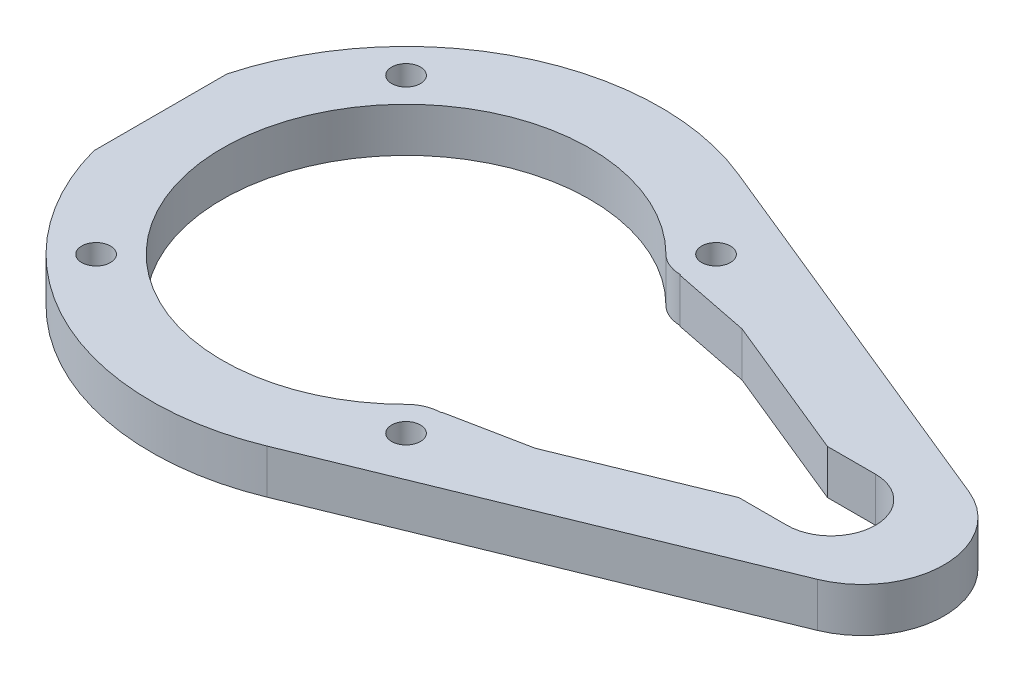
from build123d import *

# Parameters (mm, degrees)
SKETCH1_R           = 3.25
BOSS_EXTRUDE1_DEPTH = 10


with BuildPart() as part:
    # Sketch1 → Boss-Extrude1 (new body)
    with BuildSketch(Plane(origin=(0, 0, 0), x_dir=(1, 0, 0), z_dir=(0, 1, 0))):
        with BuildLine():
            ThreePointArc((21.76947877, 53.217002819), (-25.477840581, 51.544536415), (-55.5, 15.023634545))
            Line((-55.5, 15.023634545), (-55.5, -15.023634545))
            ThreePointArc((-55.5, -15.023634545), (-25.477840581, -51.544536415), (21.76947877, -53.217002819))
            Line((21.76947877, -53.217002819), (110.004400793, -17.122744217))
            ThreePointArc((110.004400793, -17.122744217), (121.5, 0), (110.004400793, 17.122744217))
            Line((110.004400793, 17.122744217), (21.76947877, 53.217002819))
        make_face()
        with Locations((-35, 35)):
            Circle(SKETCH1_R, mode=Mode.SUBTRACT)
        with BuildLine():
            ThreePointArc((29.343145829, 29.343145672), (31.938532593, 27.608963719), (35, 27))
            Line((35, 27), (35, 26.842197909))
            Line((35, 26.842197909), (52.547252782, 23.339790487))
            Line((52.547252782, 23.339790487), (85.157297123, 10))
            Line((85.157297123, 10), (96, 10))
            ThreePointArc((96, 10), (106, 0), (96, -10))
            Line((96, -10), (85.157297123, -10))
            Line((85.157297123, -10), (52.547252782, -23.339790487))
            Line((52.547252782, -23.339790487), (35, -26.842197909))
            Line((35, -26.842197909), (35, -27))
            ThreePointArc((35, -27), (31.938532454, -27.608963776), (29.343145617, -29.343145884))
            ThreePointArc((29.343145617, -29.343145884), (-41.497474683, 1.5e-07), (29.343145829, 29.343145672))
        make_face(mode=Mode.SUBTRACT)
        with Locations((35, 35)):
            Circle(SKETCH1_R, mode=Mode.SUBTRACT)
        with Locations((-35, -35)):
            Circle(SKETCH1_R, mode=Mode.SUBTRACT)
        with Locations((35, -35)):
            Circle(SKETCH1_R, mode=Mode.SUBTRACT)
    extrude(amount=BOSS_EXTRUDE1_DEPTH)


solid = part.part
